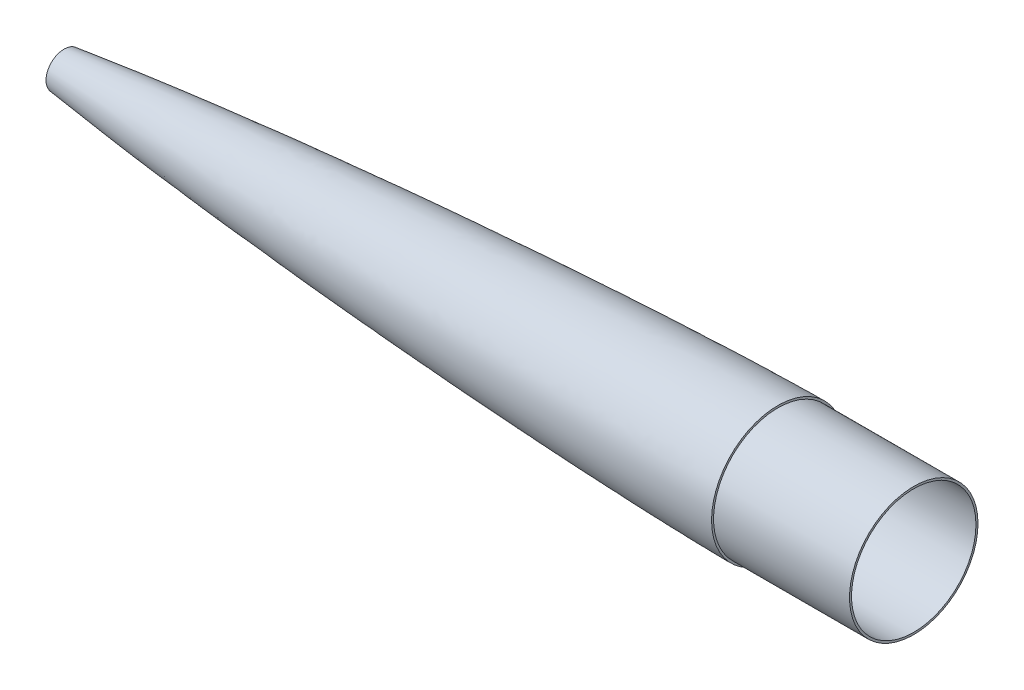
from build123d import *

# Parameters (mm, degrees)
BOSS_EXTRUDE1_DEPTH      = 101.6
BOSS_EXTRUDE1_DEPTH_BACK = 25.4
SKETCH2_R                = 48.018506502
SKETCH2_R_2              = 46.494506502


with BuildPart() as part:
    # Sketch1 → Revolve1 (revolve)
    with BuildSketch(Plane.XY):
        with BuildLine():
            add(Edge.make_bspline(
                [(76.2, 13.484253633), (80.541051361, 14.042240397), (94.160445602, 15.752086645), (117.07910842, 18.443077896), (149.319983258, 21.900765224), (186.540620523, 25.541365484), (223.788346525, 28.892582721), (261.057875937, 31.9908904), (298.345861542, 34.85826765), (335.64990165, 37.508218109), (372.968338264, 39.947038684), (410.299941718, 42.17527884), (447.643848849, 44.187159503), (484.999447818, 45.969575774), (517.695494354, 47.307189589), (545.72762747, 48.2681791), (568.326311807, 48.896405146), (583.534683102, 49.234051112), (596.024563936, 49.439736112), (603.840948359, 49.519860454), (607.749290513, 49.542506502), (609.703485351, 49.542506502)],
                knots=[0.126579539, 0.126579539, 0.126579539, 0.126579539, 0.126579539, 0.155163745, 0.216224183, 0.277284623, 0.338345063, 0.399405504, 0.460465944, 0.521526385, 0.582586825, 0.643647266, 0.704707706, 0.765768146, 0.826828587, 0.887889028, 0.918419248, 0.948949468, 0.974474734, 0.987237367, 1, 1, 1, 1, 1], degree=4))
            Line((76.2, 13.484253633), (76.2, 11.947708493))
            add(Edge.make_bspline(
                [(76.2, 11.947708493), (82.378156316, 12.742501267), (94.884009221, 14.2918782), (113.732070411, 16.484399436), (132.736266708, 18.573495042), (158.091363842, 21.221794503), (189.8102718, 24.306192238), (227.902611515, 27.708549317), (266.018568132, 30.848827321), (304.154176988, 33.749573708), (342.306680767, 36.424163266), (393.196574129, 39.695685424), (438.931967907, 42.23963824), (478.317604938, 44.104180436), (503.789466008, 45.214005638), (534.451677838, 46.389555069), (565.117800073, 47.318828106), (590.605905239, 47.841312968), (603.336130237, 48.018506502), (609.703485351, 48.018506502)],
                knots=[0.126259456, 0.126259456, 0.126259456, 0.126259456, 0.156794105, 0.188023953, 0.219253801, 0.250483649, 0.312943345, 0.375403041, 0.437862737, 0.500322433, 0.562782129, 0.625241824, 0.750161216, 0.787196768, 0.818426616, 0.875080608, 0.937540304, 0.968770152, 1, 1, 1, 1], degree=3))
            Line((609.703485351, 48.018506502), (609.703485351, 49.542506502))
        make_face()
    revolve(axis=Axis((0, 0, 0), (1, 0, 0)))

    # Sketch2 → Boss-Extrude1 (add, two sides: drawn at the far end of the back side and taken through both)
    with BuildSketch(Plane(origin=(609.703485351, 0, 0), x_dir=(0, 0, -1), z_dir=(1, 0, 0)).offset(-BOSS_EXTRUDE1_DEPTH_BACK)):
        Circle(SKETCH2_R)
        Circle(SKETCH2_R_2, mode=Mode.SUBTRACT)
    extrude(amount=BOSS_EXTRUDE1_DEPTH + BOSS_EXTRUDE1_DEPTH_BACK)


solid = part.part
